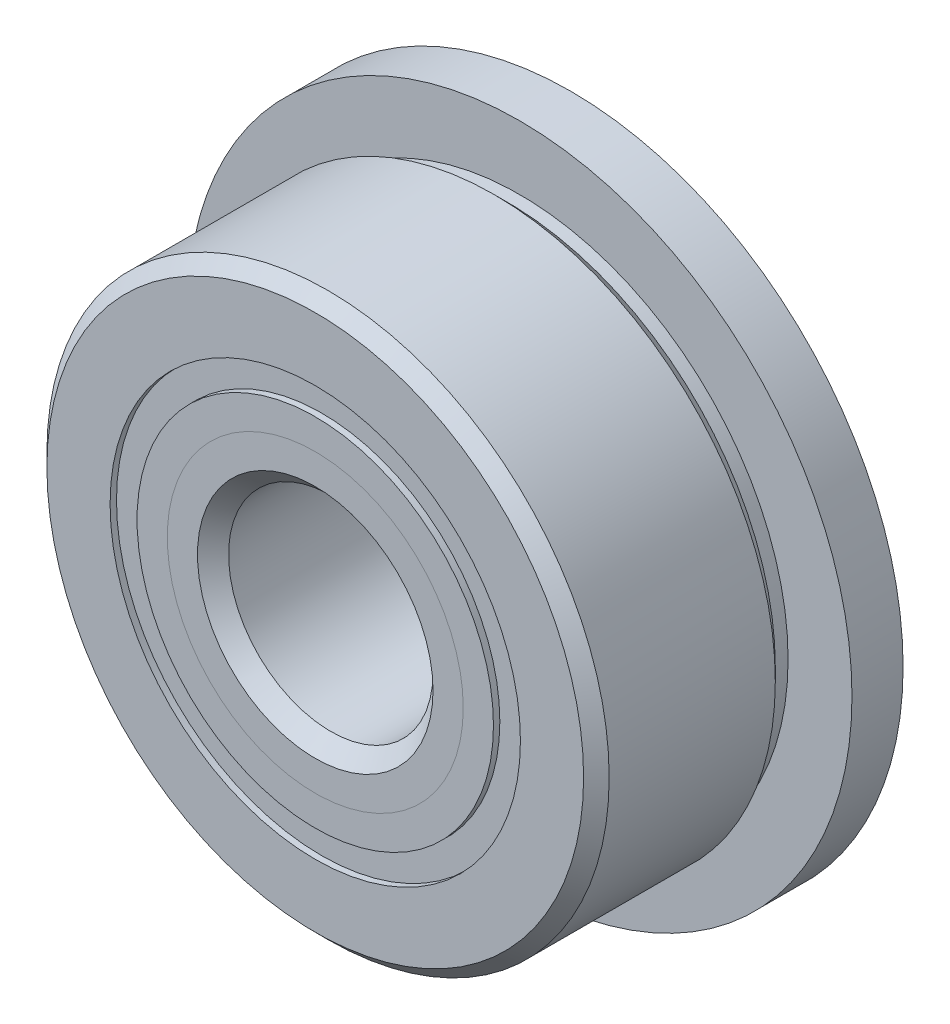
from build123d import *

# Parameters (mm, degrees)
SKETCH5_W         = 1.5875
SKETCH5_H         = 2.965659341
CIRPATTERN1_COUNT = 10
SKETCH7_W         = 1.957414803
SKETCH7_H         = 0.837362638


with BuildPart() as part:
    # Sketch1 → Revolve1 (revolve)
    with BuildSketch(Plane(origin=(0, 0, 0), x_dir=(0, 0, -1), z_dir=(1, 0, 0))):
        with BuildLine():
            Line((3.571875, 8.73125), (-3.571875, 8.73125))
            Line((-3.571875, 8.73125), (-3.96875, 8.334375))
            Line((-3.96875, 8.334375), (-3.96875, 6.371806319))
            Line((-3.96875, 6.371806319), (-1.763888889, 6.371806319))
            ThreePointArc((-1.763888889, 6.371806319), (0, 7.766022697), (1.763888889, 6.371806319))
            Line((1.763888889, 6.371806319), (3.96875, 6.371806319))
            Line((3.96875, 6.371806319), (3.96875, 8.334375))
            Line((3.96875, 8.334375), (3.571875, 8.73125))
        make_face()
    revolve(axis=Axis((0, 0, 3.96875), (0, 0, -1)))

    # Sketch5 → Revolve5 (revolve)
    with BuildSketch(Plane(origin=(0, 0, 0), x_dir=(0, 0, -1), z_dir=(1, 0, 0))):
        with Locations((3.175, 8.83592033)):
            Rectangle(SKETCH5_W, SKETCH5_H)
    revolve(axis=Axis((0, 0, -5.55625), (0, 0, 1)))

    # Sketch6 → Cut-Revolve1 (revolve, cut)
    with BuildSketch(Plane(origin=(0, 0, 0), x_dir=(0, 0, -1), z_dir=(1, 0, 0))):
        Polygon((1.5875, 8.73125), (1.984375, 8.334375), (2.38125, 8.334375), (2.38125, 8.73125), align=None)
    revolve(axis=Axis((0, 0, 3.96875), (0, 0, -1)), mode=Mode.SUBTRACT)


with BuildPart() as body_2:
    # Sketch2 → Revolve2 (revolve)
    with BuildSketch(Plane(origin=(0, 0, 0), x_dir=(0, 0, -1), z_dir=(1, 0, 0))):
        with BuildLine():
            Line((-3.96875, 5.534443681), (-1.763888889, 5.534443681))
            ThreePointArc((-1.763888889, 5.534443681), (-1.124182294, 4.530868965), (0, 4.140227303))
            Line((0, 4.140227303), (0, 3.657613652))
            Line((0, 3.657613652), (-3.030334985, 3.657613652))
            Line((-3.030334985, 3.657613652), (-3.96875, 4.596028666))
            Line((-3.96875, 4.596028666), (-3.96875, 5.534443681))
        make_face()
    revolve(axis=Axis((0, 0, 3.96875), (0, 0, -1)))


with BuildPart() as body_3:
    # Sketch3 → Revolve3 (revolve)
    with BuildSketch(Plane(origin=(0, 0, 0), x_dir=(0, 0, -1), z_dir=(1, 0, 0))):
        with BuildLine():
            Line((-3.96875, 4.596028666), (-3.030334985, 3.657613652))
            Line((-3.030334985, 3.657613652), (0, 3.657613652))
            Line((0, 3.657613652), (0, 4.140227303))
            ThreePointArc((0, 4.140227303), (1.124182294, 4.530868965), (1.763888889, 5.534443681))
            Line((1.763888889, 5.534443681), (5.55625, 5.534443681))
            Line((5.55625, 5.534443681), (5.55625, 3.571875))
            Line((5.55625, 3.571875), (5.159375, 3.175))
            Line((5.159375, 3.175), (-3.486136348, 3.175))
            Line((-3.486136348, 3.175), (-3.96875, 3.657613652))
            Line((-3.96875, 3.657613652), (-3.96875, 4.596028666))
        make_face()
    revolve(axis=Axis((0, 0, 3.96875), (0, 0, -1)))


with BuildPart() as body_4:
    # Sketch4 → Revolve4 (revolve)
    with BuildSketch(Plane(origin=(0, 0, 0), x_dir=(0, 0, -1), z_dir=(1, 0, 0))):
        with BuildLine():
            Line((-1.812897697, 5.953125), (1.812897697, 5.953125))
            ThreePointArc((1.812897697, 5.953125), (0, 7.766022697), (-1.812897697, 5.953125))
        make_face()
    revolve(axis=Axis((0, 5.953125, 1.812897697), (0, 0, -1)))


with BuildPart() as cirpattern1_1:
    # CirPattern1: pattern copy
    add(body_4.part.rotate(Axis((0, 0, -3.96875), (0, 0, 1)), 1 * 360 / CIRPATTERN1_COUNT))


with BuildPart() as cirpattern1_2:
    # CirPattern1: pattern copy
    add(body_4.part.rotate(Axis((0, 0, -3.96875), (0, 0, 1)), 2 * 360 / CIRPATTERN1_COUNT))


with BuildPart() as cirpattern1_3:
    # CirPattern1: pattern copy
    add(body_4.part.rotate(Axis((0, 0, -3.96875), (0, 0, 1)), 3 * 360 / CIRPATTERN1_COUNT))


with BuildPart() as cirpattern1_4:
    # CirPattern1: pattern copy
    add(body_4.part.rotate(Axis((0, 0, -3.96875), (0, 0, 1)), 4 * 360 / CIRPATTERN1_COUNT))


with BuildPart() as cirpattern1_5:
    # CirPattern1: pattern copy
    add(body_4.part.rotate(Axis((0, 0, -3.96875), (0, 0, 1)), 5 * 360 / CIRPATTERN1_COUNT))


with BuildPart() as cirpattern1_6:
    # CirPattern1: pattern copy
    add(body_4.part.rotate(Axis((0, 0, -3.96875), (0, 0, 1)), 6 * 360 / CIRPATTERN1_COUNT))


with BuildPart() as cirpattern1_7:
    # CirPattern1: pattern copy
    add(body_4.part.rotate(Axis((0, 0, -3.96875), (0, 0, 1)), 7 * 360 / CIRPATTERN1_COUNT))


with BuildPart() as cirpattern1_8:
    # CirPattern1: pattern copy
    add(body_4.part.rotate(Axis((0, 0, -3.96875), (0, 0, 1)), 8 * 360 / CIRPATTERN1_COUNT))


with BuildPart() as cirpattern1_9:
    # CirPattern1: pattern copy
    add(body_4.part.rotate(Axis((0, 0, -3.96875), (0, 0, 1)), 9 * 360 / CIRPATTERN1_COUNT))


with BuildPart() as body_14:
    # Sketch7 → Revolve6 (revolve)
    with BuildSketch(Plane(origin=(0, 0, 0), x_dir=(0, 0, -1), z_dir=(1, 0, 0))):
        with Locations((-2.791605099, 5.953125)):
            Rectangle(SKETCH7_W, SKETCH7_H)
        with Locations((2.791605099, 5.953125)):
            Rectangle(SKETCH7_W, SKETCH7_H)
    revolve(axis=Axis((0, 0, 3.96875), (0, 0, -1)))


solid = Compound([part.part, body_2.part, body_3.part, body_4.part, cirpattern1_1.part, cirpattern1_2.part, cirpattern1_3.part, cirpattern1_4.part, cirpattern1_5.part, cirpattern1_6.part, cirpattern1_7.part, cirpattern1_8.part, cirpattern1_9.part, body_14.part])
